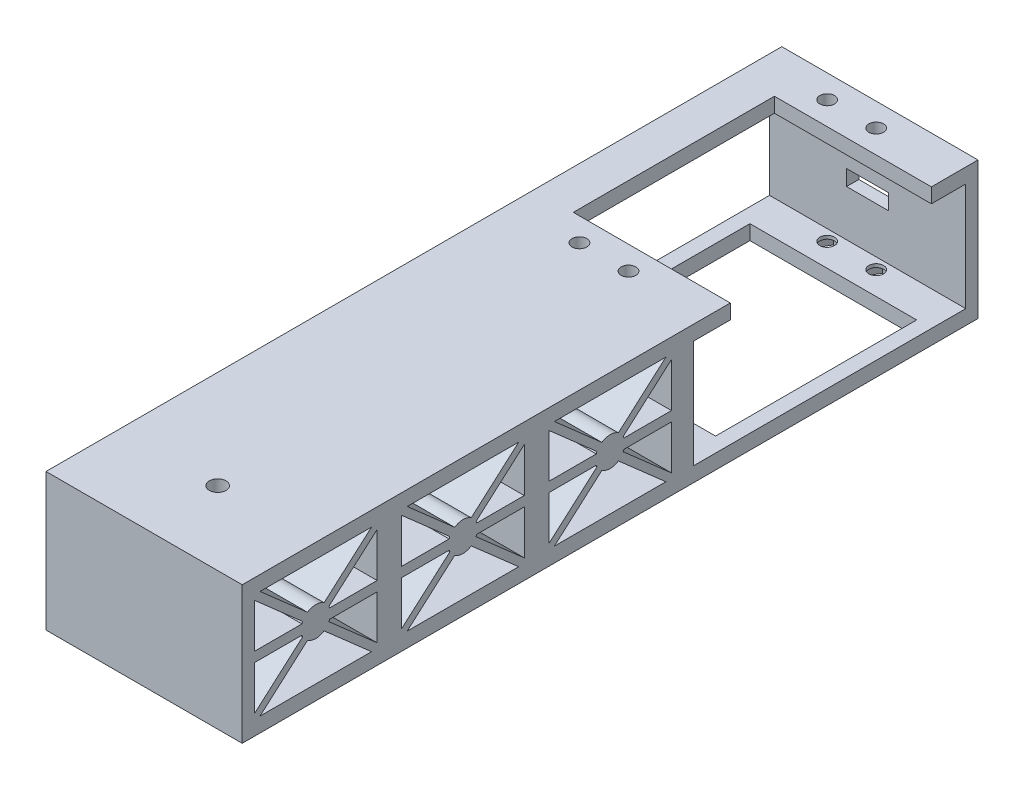
from build123d import *

# Parameters (mm, degrees)
SKETCH19_W          = 60
SKETCH19_H          = 28
SKETCH19_W_2        = 55.5
SKETCH19_H_2        = 22
BOSS_EXTRUDE1_DEPTH = 40
CUT_EXTRUDE6_REACH  = 69.082
SKETCH32_W          = 40
SKETCH32_H          = 41
CUT_EXTRUDE7_REACH  = 78
SKETCH34_W          = 8.575577682
SKETCH34_H          = 3.18613985
SKETCH36_W          = 34
SKETCH36_H          = 41
CUT_EXTRUDE9_DEPTH  = 68.082039325
SKETCH37_W          = 8
SKETCH37_H          = 3
BOSS_EXTRUDE2_DEPTH = 41
SKETCH39_R          = 1.5
CUT_EXTRUDE10_DEPTH = 68.082039325
CUT_EXTRUDE11_DEPTH = 2.32
JOIN1_START         = -40
JOIN1_DEPTH         = 40
JOIN1_2_OUTLINE_W   = 2.32
JOIN1_2_OUTLINE_H   = 6
JOIN1_2_DEPTH       = 18.267949192
JOIN1_START_2       = -18.267949192
JOIN1_3_OUTLINE_W   = 2.32
JOIN1_3_OUTLINE_H   = 6
JOIN1_3_DEPTH       = 18.267949192
JOIN1_START_3       = -21.68
JOIN1_4_OUTLINE_R   = 1.7
JOIN1_4_DEPTH       = 25.68
JOIN1_START_4       = -25
JOIN1_5_DEPTH       = 3.32


with BuildPart() as part:
    # Sketch19 → Boss-Extrude1 (new body)
    with BuildSketch(Plane(origin=(0, 0, 0), x_dir=(0, 0, -1), z_dir=(1, 0, 0))):
        with Locations((16, -10)):
            Rectangle(SKETCH19_W, SKETCH19_H)
        with Locations((15.75, -10)):
            Rectangle(SKETCH19_W_2, SKETCH19_H_2, mode=Mode.SUBTRACT)
    extrude(amount=-BOSS_EXTRUDE1_DEPTH)

    # Sketch32 → Cut-Extrude6 (cut, up to next)
    with BuildSketch(Plane(origin=(0, 4, 0), x_dir=(1, 0, 0), z_dir=(0, 1, 0)), mode=Mode.PRIVATE) as cut_extrude6_sk1:
        with Locations((-20, 16)):
            Rectangle(SKETCH32_W, SKETCH32_H)
    cut_extrude6_tool1 = extrude(cut_extrude6_sk1.sketch, amount=-CUT_EXTRUDE6_REACH, mode=Mode.PRIVATE) & part.part
    add(cut_extrude6_tool1.solids().sort_by_distance((-20, 4, -16))[0], mode=Mode.SUBTRACT)

    # Sketch34 → Cut-Extrude7 (cut, up to next)
    with BuildSketch(Plane(origin=(0, 0, -46), x_dir=(-1, 0, 0), z_dir=(0, 0, -1)), mode=Mode.PRIVATE) as cut_extrude7_sk1:
        with Locations((20, -10)):
            Rectangle(SKETCH34_W, SKETCH34_H)
    cut_extrude7_tool1 = extrude(cut_extrude7_sk1.sketch, amount=-CUT_EXTRUDE7_REACH, mode=Mode.PRIVATE) & part.part
    add(cut_extrude7_tool1.solids().sort_by_distance((-20, -10, -46))[0], mode=Mode.SUBTRACT)

    # Sketch36 → Cut-Extrude9 (cut, through all)
    with BuildSketch(Plane(origin=(0, 4, 0), x_dir=(1, 0, 0), z_dir=(0, 1, 0))):
        with Locations((-20, 16)):
            Rectangle(SKETCH36_W, SKETCH36_H)
    extrude(amount=-CUT_EXTRUDE9_DEPTH, mode=Mode.SUBTRACT)

    # Sketch37 → Boss-Extrude2 (add)
    with BuildSketch(Plane(origin=(0, 0, 4.5), x_dir=(-1, 0, 0), z_dir=(0, 0, -1))):
        with Locations((36, 2.5)):
            Rectangle(SKETCH37_W, SKETCH37_H)
    extrude(amount=BOSS_EXTRUDE2_DEPTH)

    # Sketch39 → Cut-Extrude10 (cut, through all)
    with BuildSketch(Plane(origin=(0, 4, 0), x_dir=(1, 0, 0), z_dir=(0, 1, 0))):
        with Locations(Location((-26, 41.25, 0), (0, 0, 270))):
            Circle(SKETCH39_R)
        with Locations(Location((-16, 41.25, 0), (0, 0, 270))):
            Circle(SKETCH39_R)
        with Locations(Location((-26, -9.25, 0), (0, 0, 90))):
            Circle(SKETCH39_R)
        with Locations(Location((-16, -9.25, 0), (0, 0, 90))):
            Circle(SKETCH39_R)
    extrude(amount=-CUT_EXTRUDE10_DEPTH, mode=Mode.SUBTRACT)

    # Sketch31 → Cut-Extrude11 (cut)
    with BuildSketch(Plane(origin=(0, -24, 36), x_dir=(-1, 0, 0), z_dir=(0, 1, 0))):
        Polygon((29.464101615, -26.75), (27.732050808, -23.75), (24.267949192, -23.75), (22.535898385, -26.75), (24.267949192, -29.75), (27.732050808, -29.75), align=None)
        Polygon((19.464101615, -26.75), (17.732050808, -23.75), (14.267949192, -23.75), (12.535898385, -26.75), (14.267949192, -29.75), (17.732050808, -29.75), align=None)
        Polygon((19.464101615, -77.25), (17.732050808, -74.25), (14.267949192, -74.25), (12.535898385, -77.25), (14.267949192, -80.25), (17.732050808, -80.25), align=None)
        Polygon((29.464101615, -77.25), (27.732050808, -74.25), (24.267949192, -74.25), (22.535898385, -77.25), (24.267949192, -80.25), (27.732050808, -80.25), align=None)
    extrude(amount=CUT_EXTRUDE11_DEPTH, mode=Mode.SUBTRACT)

    # Join1: read off the stored shape, not the designer's step
    # Join1 outline → Join1 (add)
    with BuildSketch(Plane.YZ.offset(JOIN1_START)):
        Polygon((4, 104), (-24, 104), (-24, 92), (-21.68, 92), (-21.68, 86), (-24, 86), (-24, 14), (4, 14), align=None)
        with BuildLine():
            ThreePointArc((-11.355915489, 26.323903367), (-11.18041755, 26.241990862), (-11, 26.171572875))
            Line((-11, 26.171572875), (-11, 16.5))
            Line((-11, 16.5), (-20.000950452, 16.5))
            Line((-20.000950452, 16.5), (-11.355915489, 26.323903367))
        make_face(mode=Mode.SUBTRACT)
        with BuildLine():
            Line((-21, 17.635283578), (-21, 40.364716422))
            Line((-21, 40.364716422), (-12.481985764, 30.68515479))
            ThreePointArc((-12.481985764, 30.68515479), (-13, 29), (-12.481985764, 27.31484521))
            Line((-12.481985764, 27.31484521), (-21, 17.635283578))
        make_face(mode=Mode.SUBTRACT)
        with BuildLine():
            Line((-20.000950452, 41.5), (-11, 41.5))
            Line((-11, 41.5), (-11, 31.828427125))
            ThreePointArc((-11, 31.828427125), (-11.18041755, 31.758009138), (-11.355915489, 31.676096633))
            Line((-11.355915489, 31.676096633), (-20.000950452, 41.5))
        make_face(mode=Mode.SUBTRACT)
        with BuildLine():
            ThreePointArc((-11.355915489, 56.323903367), (-11.18041755, 56.241990862), (-11, 56.171572875))
            Line((-11, 56.171572875), (-11, 46.5))
            Line((-11, 46.5), (-20.000950452, 46.5))
            Line((-20.000950452, 46.5), (-11.355915489, 56.323903367))
        make_face(mode=Mode.SUBTRACT)
        with BuildLine():
            Line((-9, 16.5), (-9, 26.171572875))
            ThreePointArc((-9, 26.171572875), (-8.81958245, 26.241990862), (-8.644084511, 26.323903367))
            Line((-8.644084511, 26.323903367), (0.000950452, 16.5))
            Line((0.000950452, 16.5), (-9, 16.5))
        make_face(mode=Mode.SUBTRACT)
        with BuildLine():
            Line((1, 40.364716422), (1, 17.635283578))
            Line((1, 17.635283578), (-7.518014236, 27.31484521))
            ThreePointArc((-7.518014236, 27.31484521), (-7, 29), (-7.518014236, 30.68515479))
            Line((-7.518014236, 30.68515479), (1, 40.364716422))
        make_face(mode=Mode.SUBTRACT)
        with BuildLine():
            Line((-9, 31.828427125), (-9, 41.5))
            Line((-9, 41.5), (0.000950452, 41.5))
            Line((0.000950452, 41.5), (-8.644084511, 31.676096633))
            ThreePointArc((-8.644084511, 31.676096633), (-8.81958245, 31.758009138), (-9, 31.828427125))
        make_face(mode=Mode.SUBTRACT)
        with BuildLine():
            Line((-9, 46.5), (-9, 56.171572875))
            ThreePointArc((-9, 56.171572875), (-8.81958245, 56.241990862), (-8.644084511, 56.323903367))
            Line((-8.644084511, 56.323903367), (0.000950452, 46.5))
            Line((0.000950452, 46.5), (-9, 46.5))
        make_face(mode=Mode.SUBTRACT)
        with BuildLine():
            Line((-21, 47.635283578), (-21, 70.364716422))
            Line((-21, 70.364716422), (-12.481985764, 60.68515479))
            ThreePointArc((-12.481985764, 60.68515479), (-13, 59), (-12.481985764, 57.31484521))
            Line((-12.481985764, 57.31484521), (-21, 47.635283578))
        make_face(mode=Mode.SUBTRACT)
        with BuildLine():
            Line((-20.000950452, 71.5), (-11, 71.5))
            Line((-11, 71.5), (-11, 61.828427125))
            ThreePointArc((-11, 61.828427125), (-11.18041755, 61.758009138), (-11.355915489, 61.676096633))
            Line((-11.355915489, 61.676096633), (-20.000950452, 71.5))
        make_face(mode=Mode.SUBTRACT)
        with BuildLine():
            ThreePointArc((-11.355915489, 86.323903367), (-11.18041755, 86.241990862), (-11, 86.171572875))
            Line((-11, 86.171572875), (-11, 76.5))
            Line((-11, 76.5), (-20.000950452, 76.5))
            Line((-20.000950452, 76.5), (-11.355915489, 86.323903367))
        make_face(mode=Mode.SUBTRACT)
        with BuildLine():
            Line((-21, 77.635283578), (-21, 100.364716422))
            Line((-21, 100.364716422), (-12.481985764, 90.68515479))
            ThreePointArc((-12.481985764, 90.68515479), (-13, 89), (-12.481985764, 87.31484521))
            Line((-12.481985764, 87.31484521), (-21, 77.635283578))
        make_face(mode=Mode.SUBTRACT)
        with BuildLine():
            ThreePointArc((-11, 91.828427125), (-11.18041755, 91.758009138), (-11.355915489, 91.676096633))
            Line((-11.355915489, 91.676096633), (-20.000950452, 101.5))
            Line((-20.000950452, 101.5), (-11, 101.5))
            Line((-11, 101.5), (-11, 91.828427125))
        make_face(mode=Mode.SUBTRACT)
        with BuildLine():
            Line((1, 70.364716422), (1, 47.635283578))
            Line((1, 47.635283578), (-7.518014236, 57.31484521))
            ThreePointArc((-7.518014236, 57.31484521), (-7, 59), (-7.518014236, 60.68515479))
            Line((-7.518014236, 60.68515479), (1, 70.364716422))
        make_face(mode=Mode.SUBTRACT)
        with BuildLine():
            Line((-9, 61.828427125), (-9, 71.5))
            Line((-9, 71.5), (0.000950452, 71.5))
            Line((0.000950452, 71.5), (-8.644084511, 61.676096633))
            ThreePointArc((-8.644084511, 61.676096633), (-8.81958245, 61.758009138), (-9, 61.828427125))
        make_face(mode=Mode.SUBTRACT)
        with BuildLine():
            ThreePointArc((-9, 86.171572875), (-8.81958245, 86.241990862), (-8.644084511, 86.323903367))
            Line((-8.644084511, 86.323903367), (0.000950452, 76.5))
            Line((0.000950452, 76.5), (-9, 76.5))
            Line((-9, 76.5), (-9, 86.171572875))
        make_face(mode=Mode.SUBTRACT)
        with BuildLine():
            Line((1, 100.364716422), (1, 77.635283578))
            Line((1, 77.635283578), (-7.518014236, 87.31484521))
            ThreePointArc((-7.518014236, 87.31484521), (-7, 89), (-7.518014236, 90.68515479))
            Line((-7.518014236, 90.68515479), (1, 100.364716422))
        make_face(mode=Mode.SUBTRACT)
        with BuildLine():
            ThreePointArc((-8.644084511, 91.676096633), (-8.81958245, 91.758009138), (-9, 91.828427125))
            Line((-9, 91.828427125), (-9, 101.5))
            Line((-9, 101.5), (0.000950452, 101.5))
            Line((0.000950452, 101.5), (-8.644084511, 91.676096633))
        make_face(mode=Mode.SUBTRACT)
    extrude(amount=JOIN1_DEPTH)

    # Join1 2 outline → Join1 2 (add)
    with BuildSketch(Plane.YZ.offset(JOIN1_START)):
        with Locations((-22.84, 89)):
            Rectangle(JOIN1_2_OUTLINE_W, JOIN1_2_OUTLINE_H)
    extrude(amount=JOIN1_2_DEPTH)

    # Join1 3 outline → Join1 3 (add)
    with BuildSketch(Plane.YZ.offset(JOIN1_START_2)):
        with Locations((-22.84, 89)):
            Rectangle(JOIN1_3_OUTLINE_W, JOIN1_3_OUTLINE_H)
    extrude(amount=JOIN1_3_DEPTH)

    # Join1 4 outline → Join1 4 (cut)
    with BuildSketch(Plane(origin=(0, 0, 0), x_dir=(1, 0, 0), z_dir=(0, 1, 0)).offset(JOIN1_START_3)):
        with Locations((-20, -89)):
            Circle(JOIN1_4_OUTLINE_R)
    extrude(amount=JOIN1_4_DEPTH, mode=Mode.SUBTRACT)

    # Join1 5 outline → Join1 5 (cut)
    with BuildSketch(Plane(origin=(0, 0, 0), x_dir=(1, 0, 0), z_dir=(0, 1, 0)).offset(JOIN1_START_4)):
        Polygon((-21.732050808, -86), (-23.464101615, -89), (-21.732050808, -92), align=None)
        Polygon((-18.267949192, -86), (-18.267949192, -92), (-16.535898385, -89), align=None)
    extrude(amount=JOIN1_5_DEPTH, mode=Mode.SUBTRACT)


solid = part.part
